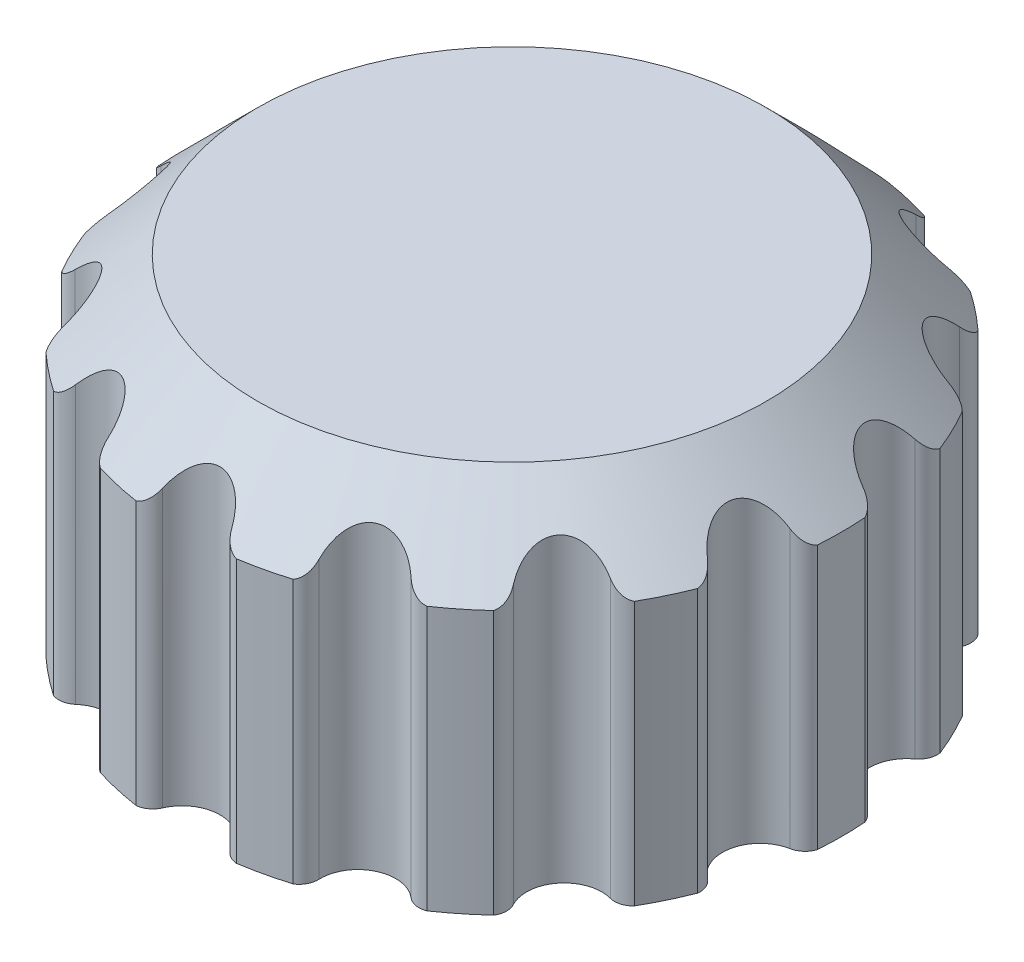
from build123d import *

# Parameters (mm, degrees)
SKETCH1_R          = 17.5
BASE_EXTRUDE_DEPTH = 18
CHAMFER2_SIZE      = 4
SIDEKNURLS_START   = -19
SIDEKNURLS_DEPTH   = 18
CIRPATTERN1_COUNT  = 14
SKETCH3_R          = 6.5
CENTREHOLE_DEPTH   = 2.6
SKETCH4_R          = 3.05
CUT_EXTRUDE3_DEPTH = 2
CUT_EXTRUDE4_DEPTH = 12.5


with BuildPart() as part:
    # Sketch1 → Base-Extrude (new body)
    with BuildSketch(Plane(origin=(0, 0, 0), x_dir=(1, 0, 0), z_dir=(0, 1, 0))):
        with Locations(Location((0, 0, 0), (0, 0, 270))):
            Circle(SKETCH1_R)
    extrude(amount=BASE_EXTRUDE_DEPTH)

    # Chamfer2
    chamfer2_edges = [part.edges().sort_by_distance(p)[0] for p in [
        (0, 18, -17.5),
    ]]
    chamfer(chamfer2_edges, length=CHAMFER2_SIZE)

    # SideKnurls: read off the stored shape, not the designer's step
    # SideKnurls outline → SideKnurls (cut)
    with BuildSketch(Plane(origin=(0, 18, 0), x_dir=(1, 0, 0), z_dir=(0, 1, 0)).offset(SIDEKNURLS_START)):
        with BuildLine():
            ThreePointArc((-2.642916007, -17.299277296), (0.013944597, -17.499994444), (2.670481952, -17.295043398))
            ThreePointArc((2.670481952, -17.295043398), (2.168942742, -17.112884259), (1.832479466, -16.698739113))
            ThreePointArc((1.832479466, -16.698739113), (-0.002587505, -15.500001674), (-1.834546596, -16.703483342))
            ThreePointArc((-1.834546596, -16.703483342), (-2.158521897, -17.110207923), (-2.642916007, -17.299277296))
        make_face()
    sideknurls = extrude(amount=SIDEKNURLS_DEPTH, mode=Mode.SUBTRACT)

    # CirPattern1: SideKnurls ×14 about axis
    cirpattern1_axis = Axis((0, 18, 0), (0, 1, 0))
    for i in range(1, CIRPATTERN1_COUNT):
        add(sideknurls.rotate(cirpattern1_axis, i * 360 / CIRPATTERN1_COUNT), mode=Mode.SUBTRACT)

    # Sketch3 → CentreHole (cut)
    with BuildSketch(Plane.XZ):
        with Locations(Location((0, 0, 0), (0, 0, 270))):
            Circle(SKETCH3_R)
    extrude(amount=-CENTREHOLE_DEPTH, mode=Mode.SUBTRACT)

    # Sketch4 → Cut-Extrude3 (cut)
    with BuildSketch(Plane.XZ.offset(-2.6)):
        with Locations(Location((0, 0, 0), (0, 0, 270))):
            Circle(SKETCH4_R)
    extrude(amount=-CUT_EXTRUDE3_DEPTH, mode=Mode.SUBTRACT)

    # Sketch5 → Cut-Extrude4 (cut)
    with BuildSketch(Plane.XZ.offset(-4.6)):
        with BuildLine():
            Line((-2.596632435, 1.6), (2.596632435, 1.6))
            ThreePointArc((2.596632435, 1.6), (0, -3.05), (-2.596632435, 1.6))
        make_face()
    extrude(amount=-CUT_EXTRUDE4_DEPTH, mode=Mode.SUBTRACT)


solid = part.part
